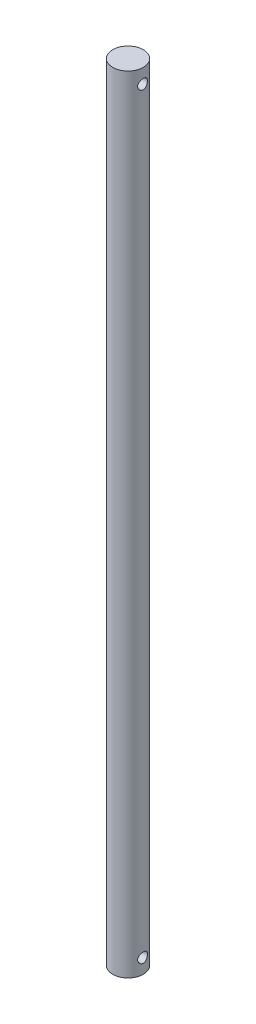
from build123d import *

# Parameters (mm, degrees)
SKETCH1_R           = 9.906
BOSS_EXTRUDE1_DEPTH = 508
CUT_EXTRUDE1_START  = 20.32
SKETCH2_R           = 3.175
CUT_EXTRUDE1_DEPTH  = 22.86


with BuildPart() as part:
    # Sketch1 → Boss-Extrude1 (new body)
    with BuildSketch(Plane(origin=(0, 0, 0), x_dir=(1, 0, 0), z_dir=(0, 1, 0))):
        Circle(SKETCH1_R)
    extrude(amount=BOSS_EXTRUDE1_DEPTH)

    # Sketch2 → Cut-Extrude1 (cut)
    with BuildSketch(Plane(origin=(0, 0, 0), x_dir=(0, 0, -1), z_dir=(1, 0, 0)).offset(CUT_EXTRUDE1_START)):
        with Locations((0, 498.602)):
            Circle(SKETCH2_R)
    cut_extrude1 = extrude(amount=-CUT_EXTRUDE1_DEPTH, mode=Mode.SUBTRACT)

    # Mirror1: Cut-Extrude1 across plane
    add(cut_extrude1.mirror(Plane.ZX.offset(254)), mode=Mode.SUBTRACT)


solid = part.part
